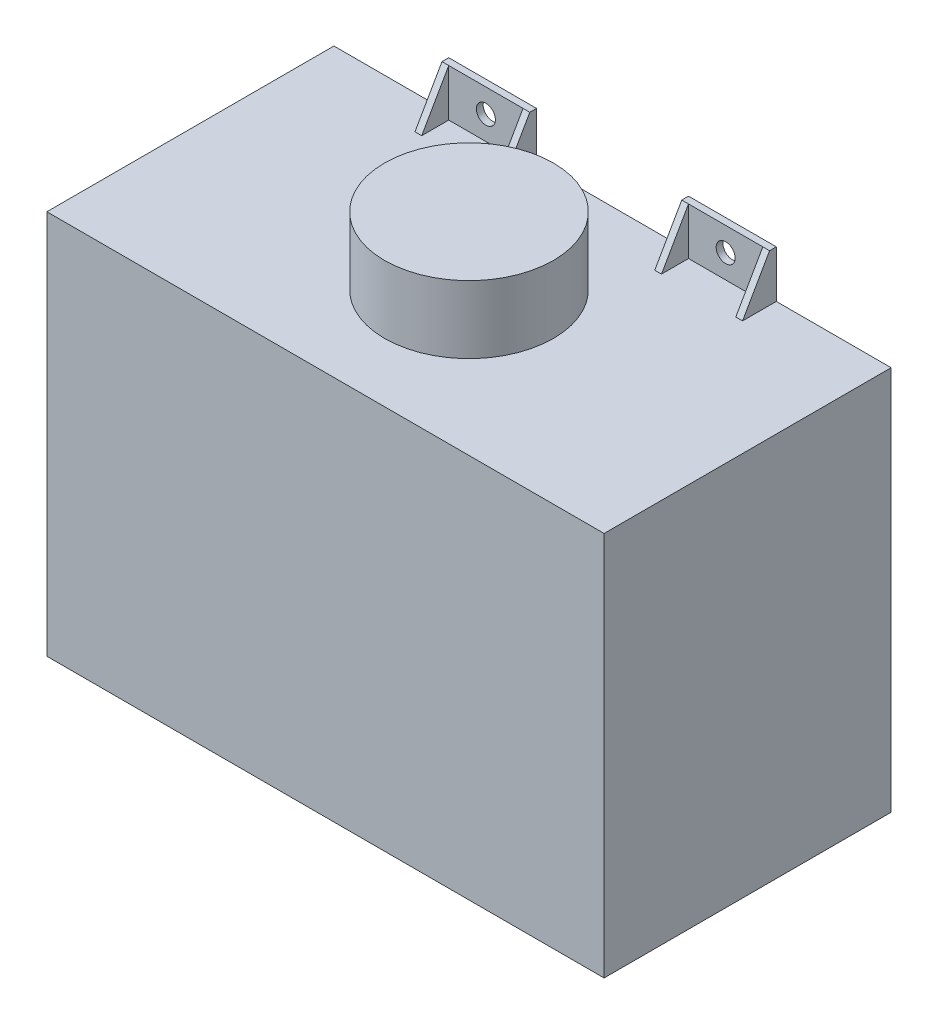
from build123d import *

# Parameters (mm, degrees)
SKETCH1_W               = 209.55
SKETCH1_H               = 107.95
BOSS_EXTRUDE1_DEPTH     = 144.78
SKETCH2_R               = 31.75
BOSS_EXTRUDE2_DEPTH     = 25.4
BOSS_EXTRUDE3_DEPTH     = 17.78
CUT_EXTRUDE2_DEPTH      = 225.36716588
CUT_EXTRUDE2_DEPTH_BACK = 225.36716588
F_1_4_CLEARANCE_HOLE1_D = 7.14248


with BuildPart() as part:
    # Sketch1 → Boss-Extrude1 (new body)
    with BuildSketch(Plane(origin=(0, 0, 0), x_dir=(1, 0, 0), z_dir=(0, 1, 0))):
        Rectangle(SKETCH1_W, SKETCH1_H)
    extrude(amount=BOSS_EXTRUDE1_DEPTH)

    # Sketch2 → Boss-Extrude2 (add)
    with BuildSketch(Plane(origin=(0, 144.78, 0), x_dir=(1, 0, 0), z_dir=(0, 1, 0))):
        Circle(SKETCH2_R)
    extrude(amount=BOSS_EXTRUDE2_DEPTH)

    # Sketch3 → Boss-Extrude3 (add)
    with BuildSketch(Plane(origin=(0, 144.78, 0), x_dir=(1, 0, 0), z_dir=(0, 1, 0))):
        Polygon((-61.595, 53.975), (-61.595, 41.275), (-59.055, 41.275), (-59.055, 51.435), (-31.115, 51.435), (-31.115, 41.275), (-28.575, 41.275), (-28.575, 53.975), align=None)
        Polygon((28.575, 53.975), (61.595, 53.975), (61.595, 41.275), (59.055, 41.275), (59.055, 51.435), (31.115, 51.435), (31.115, 41.275), (28.575, 41.275), align=None)
    extrude(amount=BOSS_EXTRUDE3_DEPTH)

    # Sketch5 → Cut-Extrude2 (cut, two sides: drawn at the far end of the back side and taken through both)
    with BuildSketch(Plane(origin=(31.115, 0, 0), x_dir=(0, 0, -1), z_dir=(1, 0, 0)).offset(-CUT_EXTRUDE2_DEPTH_BACK)):
        Polygon((41.275, 162.56), (41.275, 144.78), (51.435, 162.56), align=None)
    extrude(amount=CUT_EXTRUDE2_DEPTH + CUT_EXTRUDE2_DEPTH_BACK, mode=Mode.SUBTRACT)

    # 1/4 Clearance Hole1 (through all)
    with Locations(Plane(origin=(-45.085, 153.67, -51.435), x_dir=(1, 0, 0), z_dir=(0, 0, 1))):
        with Locations((0, 0), (90.17, 0)):
            Hole(F_1_4_CLEARANCE_HOLE1_D / 2)


solid = part.part
